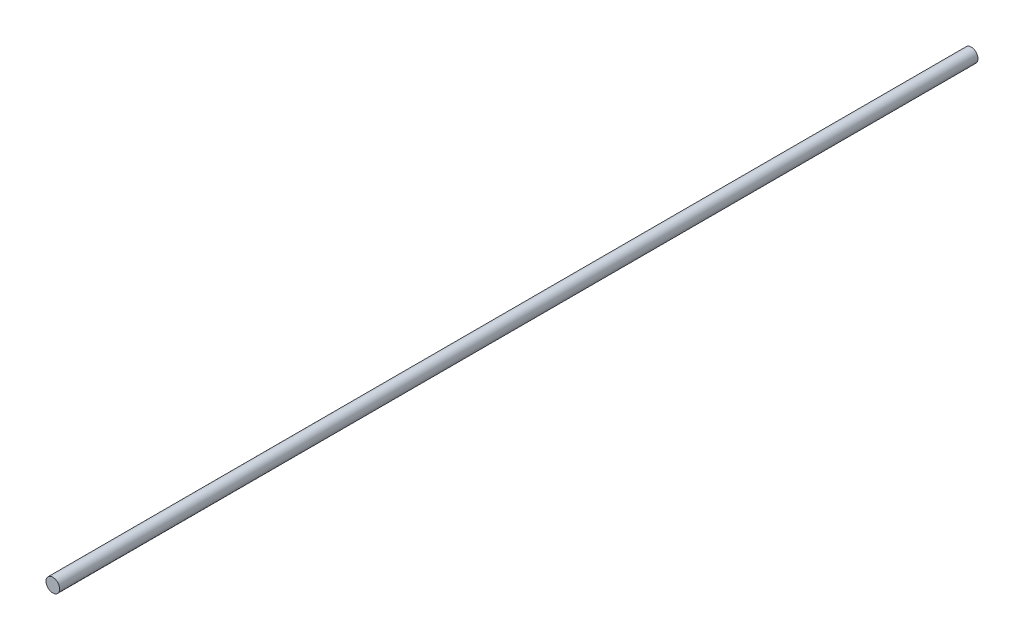
from build123d import *

# Parameters (mm, degrees)
SKETCH1_R           = 5
BOSS_EXTRUDE1_DEPTH = 674


with BuildPart() as part:
    # Sketch1 → Boss-Extrude1 (new body)
    with BuildSketch(Plane.XY):
        Circle(SKETCH1_R)
    extrude(amount=BOSS_EXTRUDE1_DEPTH)


solid = part.part
